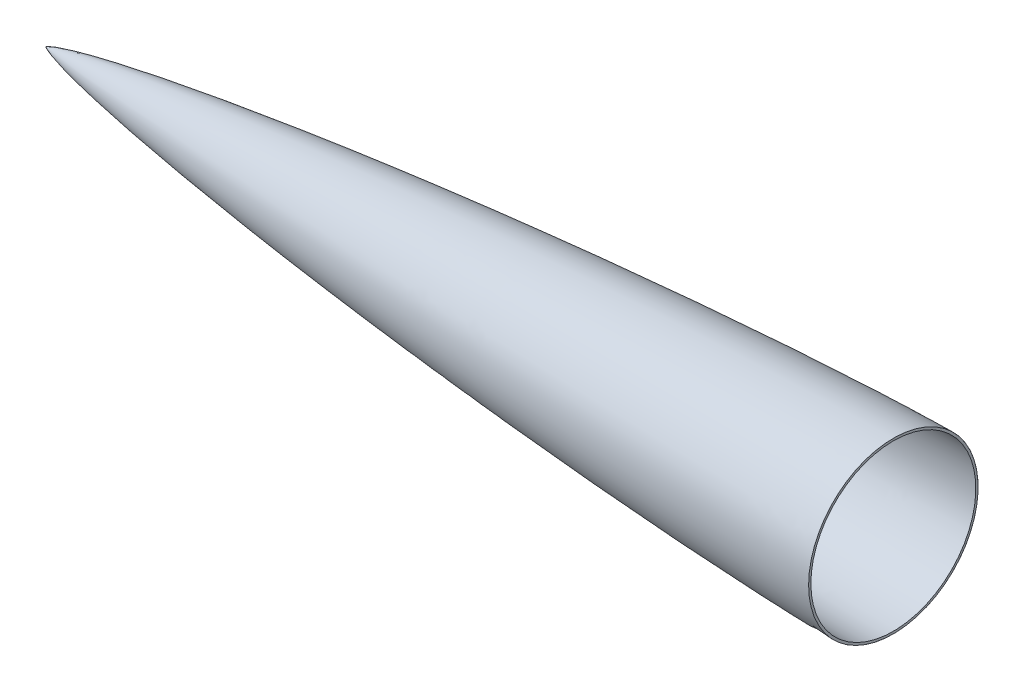
from build123d import *


with BuildPart() as part:
    # Sketch2 → Revolve1 (revolve)
    with BuildSketch(Plane.XY):
        with BuildLine():
            add(Edge.make_bspline(
                [(0, 0), (0.002661369, 0.00735768), (0.009108664, 0.021455176), (0.026858739, 0.047022825), (0.06841925, 0.093346235), (0.131428409, 0.1510252), (0.216810716, 0.21833703), (0.338162364, 0.304110587), (0.48394243, 0.397396692), (0.655054985, 0.498068807), (0.851568565, 0.605626998), (1.137654509, 0.753350528), (1.581543682, 0.966113556), (2.335050733, 1.296122672), (3.682901567, 1.826629283), (6.111473252, 2.674476309), (10.574628301, 4.037968264), (18.951733743, 6.252001296), (33.570100518, 9.565304084), (58.406653249, 14.407879587), (92.507874052, 20.12088369), (133.842049801, 26.225056743), (179.809214733, 32.306451647), (225.84209313, 37.86321125), (271.925422623, 42.983912816), (318.04912254, 47.72529812), (364.207064366, 52.120679156), (410.394737335, 56.191009866), (456.609131982, 59.945893406), (502.84798368, 63.386478656), (549.109760477, 66.50424795), (595.393392595, 69.279792224), (635.910176338, 71.377324916), (670.6520208, 72.898528506), (698.66827638, 73.906563077), (717.52848444, 74.458019085), (733.022602025, 74.804058757), (742.723636447, 74.948033977), (747.57448889, 74.993969324), (750, 75)],
                knots=[0, 0, 0, 0, 0, 4.1103e-05, 8.2207e-05, 0.000164413, 0.000328826, 0.000493239, 0.000657652, 0.000951494, 0.001245335, 0.001544792, 0.001844249, 0.002657057, 0.00385252, 0.005901677, 0.009515863, 0.016280764, 0.028569004, 0.051793804, 0.088907366, 0.150314205, 0.211721038, 0.273127872, 0.334534706, 0.395941541, 0.457348376, 0.518755211, 0.580162046, 0.641568881, 0.702975716, 0.764382551, 0.825789386, 0.887196222, 0.917899639, 0.948603057, 0.974301528, 0.987150764, 1, 1, 1, 1, 1], degree=4))
            Line((0, 0), (4.552555597, 0))
            add(Edge.make_bspline(
                [(4.552555597, 0), (5.445018222, 0.324851789), (7.238985949, 0.923010218), (10.928879317, 2.035076929), (17.470823328, 3.796049572), (26.944450926, 6.017468658), (38.38710912, 8.424081686), (53.706714586, 11.398322285), (72.931846424, 14.792456575), (96.067919313, 18.526465576), (119.249807278, 22.00672428), (150.202374057, 26.376394952), (188.95728034, 31.415002087), (235.531471027, 36.945375998), (282.157954731, 42.042348478), (328.825989737, 46.759546557), (391.096739156, 52.583813797), (469.010319037, 59.042664613), (547.004359649, 64.433928433), (609.441331189, 68.031853787), (656.287575483, 70.324980762), (695.342084637, 71.829704962), (722.680234864, 72.586297012), (738.305795074, 72.888338901), (746.103809692, 72.990306515), (750.00497269, 73.000006182)],
                knots=[0.005736518, 0.005736518, 0.005736518, 0.005736518, 0.00962036, 0.013504202, 0.021271885, 0.036807252, 0.052342619, 0.067877986, 0.09894872, 0.130019453, 0.161090187, 0.192160921, 0.254302389, 0.316443856, 0.378585324, 0.440726791, 0.502868259, 0.627151194, 0.75143413, 0.813575597, 0.875717065, 0.937858532, 0.968929266, 0.984464633, 1, 1, 1, 1], degree=3))
            Line((750.00497269, 73.000006182), (750.00497269, 75))
            Line((750.00497269, 75), (750, 75))
        make_face()
    revolve(axis=Axis((0, 0, 0), (1, 0, 0)))


solid = part.part
